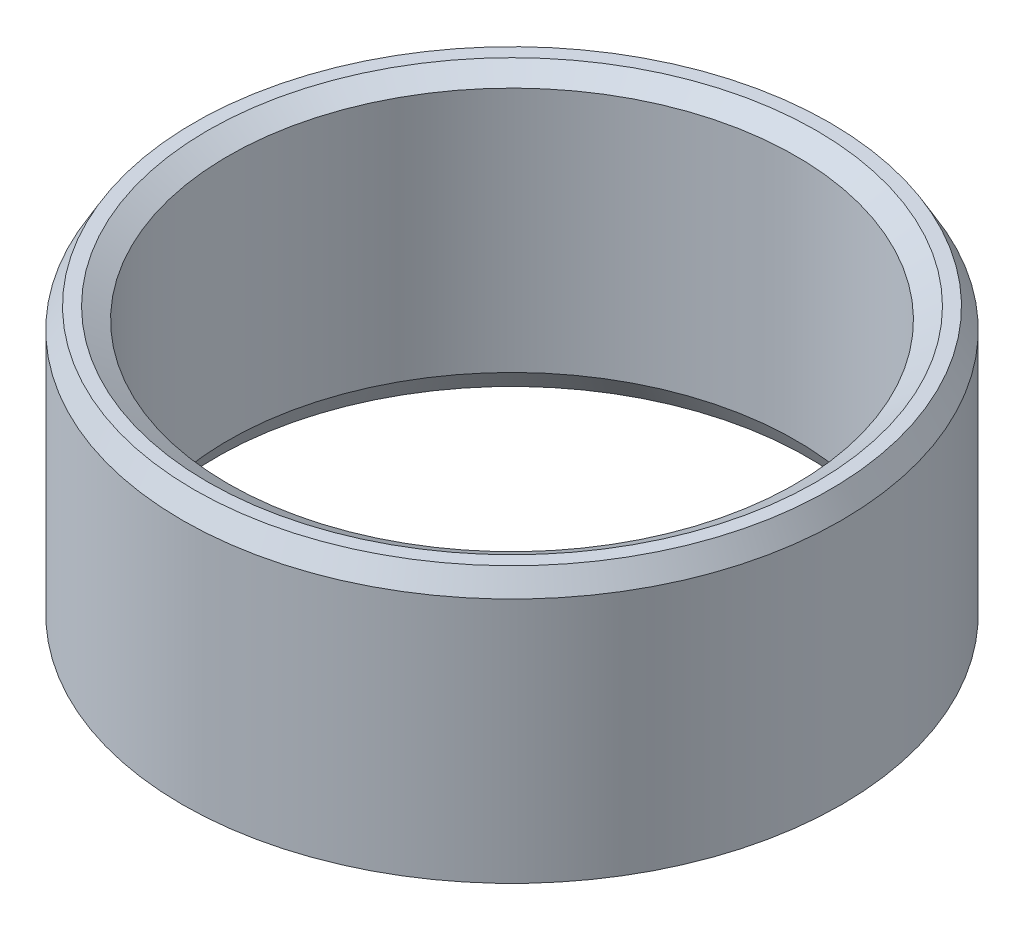
from build123d import *
from OCP.BRepFilletAPI import BRepFilletAPI_MakeChamfer

# Parameters (mm, degrees)
SKETCH1_R           = 55
BOSS_EXTRUDE1_DEPTH = 46.474739133
SKETCH2_R           = 47.357204349
CUT_EXTRUDE1_DEPTH  = 91.608506099
CHAMFER1_SIZE       = 3.420176272
CHAMFER1_SIZE2      = 1.974639691


with BuildPart() as part:
    # Sketch1 → Boss-Extrude1 (new body)
    with BuildSketch(Plane(origin=(0, 0, 0), x_dir=(1, 0, 0), z_dir=(0, 1, 0))):
        Circle(SKETCH1_R)
    extrude(amount=BOSS_EXTRUDE1_DEPTH)

    # Sketch2 → Cut-Extrude1 (cut, through all)
    with BuildSketch(Plane(origin=(0, 0, 0), x_dir=(1, 0, 0), z_dir=(0, 1, 0))):
        Circle(SKETCH2_R)
    extrude(amount=CUT_EXTRUDE1_DEPTH, mode=Mode.SUBTRACT)

    # Chamfer1: one chamfer whose edges measure the first distance from different faces: ONE call of the kernel's chamfer builder (chamfer() names one face for all edges)
    chamfer1_edges_1 = [part.edges().sort_by_distance(p)[0] for p in [
        (-47.357204349, 46.474739133, 0),
    ]]
    chamfer1_side_1 = [part.faces().sort_by_distance(p)[0] for p in [
        (-53.444365081, 46.474739133, 0),
    ]]
    chamfer1_edges_2 = [part.edges().sort_by_distance(p)[0] for p in [
        (-47.357204349, 0, 0),
    ]]
    chamfer1_side_2 = [part.faces().sort_by_distance(p)[0] for p in [
        (-47.357204349, 23.237369566, 0),
    ]]
    chamfer1_edges_3 = [part.edges().sort_by_distance(p)[0] for p in [
        (-55, 0, 0),
    ]]
    chamfer1_side_3 = [part.faces().sort_by_distance(p)[0] for p in [
        (-53.444365081, 0, 0),
    ]]
    chamfer1_edges_4 = [part.edges().sort_by_distance(p)[0] for p in [
        (-55, 46.474739133, 0),
    ]]
    chamfer1_side_4 = [part.faces().sort_by_distance(p)[0] for p in [
        (-55, 23.237369566, 0),
    ]]
    chamfer1 = BRepFilletAPI_MakeChamfer(part.part.solid().wrapped)
    for e in chamfer1_edges_1:
        chamfer1.Add(CHAMFER1_SIZE, CHAMFER1_SIZE2, e.wrapped, chamfer1_side_1[0].wrapped)  # the first distance lies on this face
    for e in chamfer1_edges_2:
        chamfer1.Add(CHAMFER1_SIZE, CHAMFER1_SIZE2, e.wrapped, chamfer1_side_2[0].wrapped)  # the first distance lies on this face
    for e in chamfer1_edges_3:
        chamfer1.Add(CHAMFER1_SIZE, CHAMFER1_SIZE2, e.wrapped, chamfer1_side_3[0].wrapped)  # the first distance lies on this face
    for e in chamfer1_edges_4:
        chamfer1.Add(CHAMFER1_SIZE, CHAMFER1_SIZE2, e.wrapped, chamfer1_side_4[0].wrapped)  # the first distance lies on this face
    add(Compound.cast(chamfer1.Shape()), mode=Mode.REPLACE)


solid = part.part
